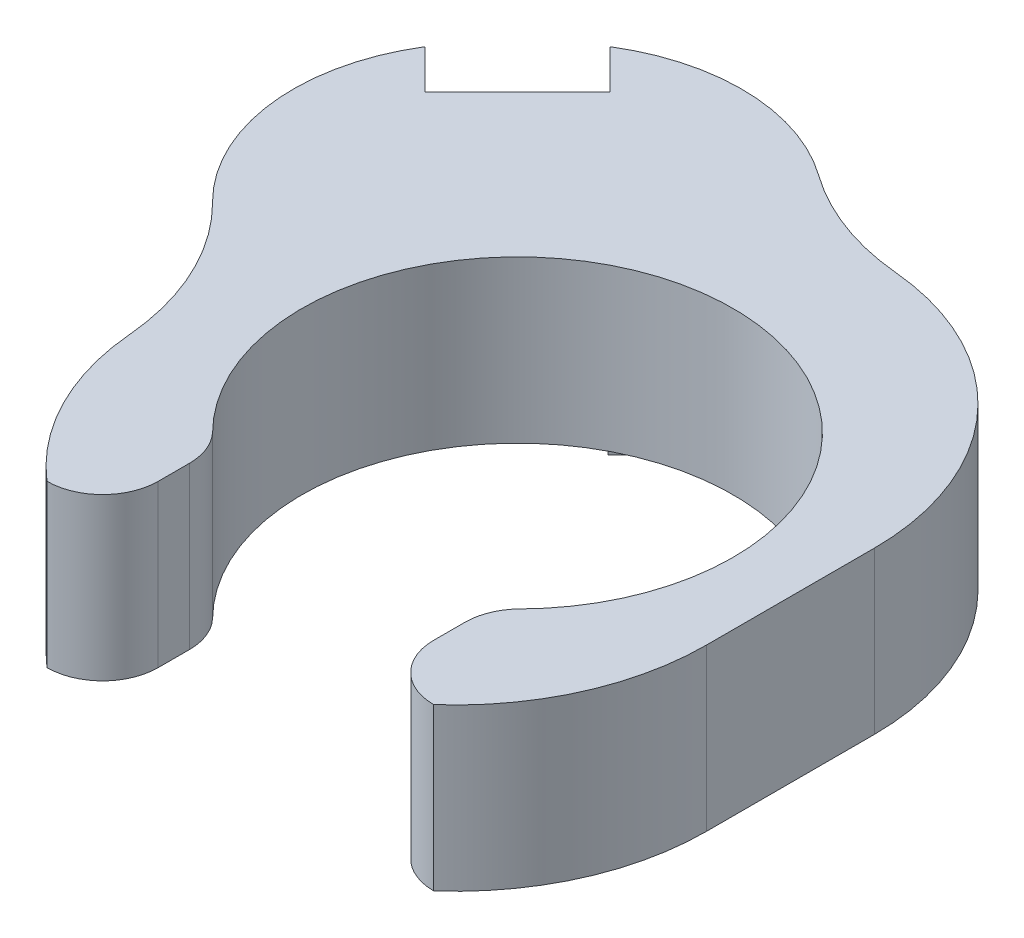
from build123d import *

# Parameters (mm, degrees)
BOSS_EXTRUDE1_DEPTH = 5.8
BOSS_EXTRUDE2_START = -5.8
BOSS_EXTRUDE2_DEPTH = 5.8
BOSS_EXTRUDE3_DEPTH = 10.3
CUT_EXTRUDE1_DEPTH  = 28.136753542647067
FILLET6_R           = 7
FILLET7_R           = 7
FILLET8_R           = 9
FILLET9_R           = 9
FILLET10_R          = 9
FILLET11_R          = 9
FILLET12_DEPTH      = 5.8
FILLET13_R          = 1.5
SKETCH11_W          = 21.348059672619552
SKETCH11_H          = 18.787798547860945
CUT_EXTRUDE3_DEPTH  = 3.048
BOSS_EXTRUDE4_DEPTH = 0.508


with BuildPart() as part:
    # Sketch1 → Boss-Extrude1 (new body)
    with BuildSketch(Plane(origin=(0, 0, 0), x_dir=(1, 0, 0), z_dir=(0, 1, 0))):
        with BuildLine():
            Line((10.000000000000004, 12.250000000000004), (-9.999999999999996, 12.250000000000002))
            Line((-9.999999999999996, 12.250000000000002), (-9.999999999999995, -7.463220606350221))
            Line((-9.999999999999995, -7.463220606350221), (-9.999999999999995, -9.463220606350236))
            Line((-9.999999999999995, -9.463220606350236), (-7.999999999999981, -9.463220606350236))
            Line((-7.999999999999981, -9.463220606350236), (-6.9500000000000055, -9.463220606350236))
            ThreePointArc((-6.9500000000000055, -9.463220606350236), (-5.535786437626896, -8.87743416872333), (-4.949999999999991, -7.46322060635022))
            Line((-4.949999999999991, -7.46322060635022), (-4.949999999999991, -6.3381283989115085))
            ThreePointArc((-4.949999999999991, -6.3381283989115085), (-5.099151268838792, -5.580263652166434), (-5.524358974358968, -4.935435394006584))
            ThreePointArc((-5.524358974358968, -4.935435394006584), (-2.97e-15, 8.249999999999998), (5.524358974358974, -4.935435394006577))
            ThreePointArc((5.524358974358974, -4.935435394006577), (5.0991512688388, -5.580263652166426), (4.95, -6.3381283989115))
            Line((4.95, -6.3381283989115), (4.95, -7.463220606350221))
            ThreePointArc((4.95, -7.463220606350221), (5.535786437626904, -8.87743416872333), (6.9500000000000135, -9.463220606350236))
            Line((6.9500000000000135, -9.463220606350236), (7.999999999999991, -9.463220606350236))
            Line((7.999999999999991, -9.463220606350236), (10.000000000000005, -9.463220606350236))
            Line((10.000000000000005, -9.463220606350236), (10.000000000000005, -7.463220606350221))
            Line((10.000000000000005, -7.463220606350221), (10.000000000000004, 12.250000000000004))
        make_face()
    extrude(amount=BOSS_EXTRUDE1_DEPTH)

    # Sketch5 → Boss-Extrude2 (add)
    with BuildSketch(Plane(origin=(0, 5.8, 0), x_dir=(1, 0, 0), z_dir=(0, 1, 0)).offset(BOSS_EXTRUDE2_START)):
        with BuildLine():
            Line((5.480077554195752, 5.980077554195732), (-6.5407377259755695, 18.00089283436707))
            Line((-6.5407377259755695, 18.00089283436707), (-17.500892834367058, 7.040737725975579))
            Line((-17.500892834367058, 7.040737725975579), (-5.480077554195753, -4.980077554195728))
            ThreePointArc((-5.480077554195753, -4.980077554195728), (-5.480077554195729, 5.980077554195754), (5.480077554195752, 5.980077554195732))
        make_face()
    extrude(amount=BOSS_EXTRUDE2_DEPTH)

    # Sketch7 → Boss-Extrude3 (add)
    with BuildSketch(Plane(origin=(0, 5.8, 0), x_dir=(1, 0, 0), z_dir=(0, 1, 0))):
        Polygon((-1.5909902576697432, 13.051145366061235), (-6.5407377259755775, 18.000892834367068), (-17.500892834367054, 7.040737725975589), (-12.551145366061204, 2.090990257669775), align=None)
    extrude(amount=-BOSS_EXTRUDE3_DEPTH)

    # Sketch8 → Cut-Extrude1 (cut, through all)
    with BuildSketch(Plane(origin=(0, 5.8, 0), x_dir=(1, 0, 0), z_dir=(0, 1, 0))):
        Polygon((-10.359114344382938, 14.1825162159597), (-8.944900782009844, 12.768302653586604), (-12.268302653586618, 9.444900782009832), (-13.682516215959716, 10.85911434438293), align=None)
    extrude(amount=-CUT_EXTRUDE1_DEPTH, mode=Mode.SUBTRACT)

    # Fillet6
    # the kernel refuses this fillet: 7 mm, written as the material it takes off along each edge
    with BuildSketch(Plane(origin=(-17.500892834367054, 22.8367250374008, -7.0407377259755775), x_dir=(0.7071067811865466, 0, 0.7071067811865486), z_dir=(0, -1, -4.3e-16))) as fillet6_piece_1:
        with BuildLine():
            CenterArc((6.814690014960312, -7.000000000000001), FILLET6_R, 89.99999999999993, 76.78701963984129)
            Line((-1.186e-14, -5.399999999999976), (-0.13629380029921795, -5.367999999999976))
            ThreePointArc((-0.13629380029921795, -5.367999999999976), (-0.1400000000000006, -2.6999999999999877), (-0.13999999999999937, -4.3e-16))
            Line((-0.13999999999999937, -4.3e-16), (8.2e-16, 0.13999999999999935))
            Line((8.2e-16, 0.13999999999999935), (6.81469001496032, 0.1400000000000004))
            Line((6.81469001496032, 0.1400000000000004), (6.814690014960321, -2.2e-16))
        make_face()
    extrude(amount=44.373450074801596, mode=Mode.SUBTRACT)

    # Fillet7
    # the kernel refuses this fillet: 7 mm, written as the material it takes off along each edge
    with BuildSketch(Plane(origin=(-6.540737725975586, -21.536725037400856, -18.00089283436706), x_dir=(0.7071067811865474, 0, 0.7071067811865478), z_dir=(5.2e-16, 1, -3.4e-16))) as fillet7_piece_1:
        with BuildLine():
            CenterArc((6.814690014960341, -7.000000000000002), FILLET7_R, 89.99999999999999, 76.78701963984157)
            Line((1e-14, -5.400000000000016), (-0.13629380029919633, -5.368000000000017))
            ThreePointArc((-0.13629380029919633, -5.368000000000017), (-0.13999999999999482, -2.700000000000007), (-0.13999999999999935, -6.8e-16))
            Line((-0.13999999999999935, -6.8e-16), (5.8e-16, 0.13999999999999937))
            Line((5.8e-16, 0.13999999999999937), (6.814690014960345, 0.13999999999999904))
            Line((6.814690014960345, 0.13999999999999904), (6.814690014960344, -5.9e-16))
        make_face()
    extrude(amount=44.37345007480171, mode=Mode.SUBTRACT)

    # Fillet8
    # the kernel refuses this fillet: 9 mm, written as the material it adds along each edge
    with BuildSketch(Plane(origin=(-0.7898448916085115, 5.8, -12.250000000000004), x_dir=(-0.7337802799425581, 0, -0.6793868564870981), z_dir=(0, -1, 0))) as fillet8_piece_1_section:
        with BuildLine():
            CenterArc((3.604279607820477, 8.928149183642457), FILLET8_R, 227.20425159265537, 35.551028784730306)
            Line((-2.510202100563517, 2.324126664159537), (-3.1216502714019168, 1.6637244122112442))
            Line((-3.1216502714019168, 1.6637244122112442), (-0.6114481708383885, -0.6604022519483025))
            Line((-0.6114481708383885, -0.6604022519483025), (0.03461576271957774, -0.8993340586074459))
            ThreePointArc((0.03461576271957774, -0.8993340586074459), (1.3519409332588244, -0.8486296344936657), (2.3558149078406787, -0.8928149183642455))
            Line((2.3558149078406787, -0.8928149183642455), (2.469311698747933, -1.2e-16))
        make_face()
    fillet8_piece_1 = extrude(amount=5.8, mode=Mode.PRIVATE)
    fillet8_piece_1 = split(fillet8_piece_1, bisect_by=Plane(origin=(-1.5909902576697426, 5.8, -13.051145366061235), z_dir=(-0.7071067811865475, 0, -0.7071067811865476)), keep=Keep.TOP, mode=Mode.PRIVATE)
    add(fillet8_piece_1)
    with BuildSketch(Plane(origin=(-0.7898448916085115, 5.8, -12.250000000000004), x_dir=(-0.7337802799425581, 0, -0.6793868564870981), z_dir=(0, -1, 0))) as fillet8_piece_2_section:
        with BuildLine():
            CenterArc((3.604279607820477, 8.928149183642457), FILLET8_R, 227.20425159265537, 35.551028784730306)
            Line((-2.510202100563517, 2.324126664159537), (-3.1216502714019168, 1.6637244122112442))
            Line((-3.1216502714019168, 1.6637244122112442), (-0.6114481708383885, -0.6604022519483025))
            Line((-0.6114481708383885, -0.6604022519483025), (0.03461576271957774, -0.8993340586074459))
            ThreePointArc((0.03461576271957774, -0.8993340586074459), (1.3519409332588244, -0.8486296344936657), (2.3558149078406787, -0.8928149183642455))
            Line((2.3558149078406787, -0.8928149183642455), (2.469311698747933, -1.2e-16))
        make_face()
    fillet8_piece_2 = extrude(amount=5.8, mode=Mode.PRIVATE)
    fillet8_piece_2 = split(fillet8_piece_2, bisect_by=Plane(origin=(-1.5909902576697428, 5.8, -13.051145366061235), z_dir=(0.7071067811865475, 0, 0.7071067811865476)), keep=Keep.TOP, mode=Mode.PRIVATE)
    add(fillet8_piece_2)
    with BuildSketch(Plane(origin=(-0.7898448916085115, 5.8, -12.250000000000004), x_dir=(-0.7337802799425581, 0, -0.6793868564870981), z_dir=(0, -1, 0))) as fillet8_piece_3_section:
        with BuildLine():
            CenterArc((3.604279607820477, 8.928149183642457), FILLET8_R, 227.20425159265537, 35.551028784730306)
            Line((-2.510202100563517, 2.324126664159537), (-3.1216502714019168, 1.6637244122112442))
            Line((-3.1216502714019168, 1.6637244122112442), (-0.6114481708383885, -0.6604022519483025))
            Line((-0.6114481708383885, -0.6604022519483025), (0.03461576271957774, -0.8993340586074459))
            ThreePointArc((0.03461576271957774, -0.8993340586074459), (1.3519409332588244, -0.8486296344936657), (2.3558149078406787, -0.8928149183642455))
            Line((2.3558149078406787, -0.8928149183642455), (2.469311698747933, -1.2e-16))
        make_face()
    fillet8_piece_3 = extrude(amount=14.35229477126272, mode=Mode.PRIVATE)
    fillet8_piece_3 = split(fillet8_piece_3, bisect_by=Plane(origin=(-0.7898448916085115, 0, -12.250000000000004), z_dir=(0, -1, 0)), keep=Keep.TOP, mode=Mode.PRIVATE)
    fillet8_piece_3 = split(fillet8_piece_3, bisect_by=Plane(origin=(-1.5909902576697426, 5.8, -13.051145366061235), z_dir=(-0.7071067811865475, 0, -0.7071067811865476)), keep=Keep.TOP, mode=Mode.PRIVATE)
    fillet8_piece_3 = split(fillet8_piece_3, bisect_by=Plane(origin=(-0.7898448916085115, -4.500000000000001, -12.250000000000004), z_dir=(0, 1, 0)), keep=Keep.TOP, mode=Mode.PRIVATE)
    add(fillet8_piece_3)

    # Fillet9
    fillet9_edges = [part.edges().sort_by_distance(p)[0] for p in [
        (10.000000000000004, 2.9, -12.250000000000004),
    ]]
    fillet(fillet9_edges, radius=FILLET9_R)

    # Fillet10
    fillet10_edges = [part.edges().sort_by_distance(p)[0] for p in [
        (-9.999999999999993, 2.9, 0.4601551083914859),
    ]]
    fillet(fillet10_edges, radius=FILLET10_R)

    # Fillet11
    # the kernel refuses this fillet: 9 mm, written as the material it takes off along each edge
    with BuildSketch(Plane(origin=(10.000000000000005, -16.88148023723037, 9.463220606350236), x_dir=(0, 0, -1), z_dir=(0, 1, 0))) as fillet11_piece_1:
        with BuildLine():
            CenterArc((6.752592094892147, 9), FILLET11_R, 221.38466758720216, 48.61533241279784)
            Line((0, 3.049999999999992), (0, 0))
            Line((0, 0), (6.752592094892147, 0))
        make_face()
    extrude(amount=39.56296047446074, mode=Mode.SUBTRACT)

    # Fillet12: read off the stored shape, not the designer's step
    # Fillet12 outline → Fillet12 (cut)
    with BuildSketch(Plane(origin=(0, 0, 0), x_dir=(1, 0, 0), z_dir=(0, 1, 0))):
        with BuildLine():
            Line((-10, -9.463220606), (-6.95, -9.463220606))
            ThreePointArc((-6.95, -9.463220606), (-9.082460071, -6.743546791), (-10.032769562, -3.42075828))
            ThreePointArc((-10.032769562, -3.42075828), (-10.008196123, -3.804068015), (-10, -4.18807717))
            Line((-10, -4.18807717), (-10, -9.463220606))
        make_face()
    extrude(amount=FILLET12_DEPTH, mode=Mode.SUBTRACT)

    # Fillet13
    fillet13_edges = [part.edges().sort_by_distance(p)[0] for p in [
        (-6.988797537188352, 0, -7.653338086542639),
    ]]
    fillet(fillet13_edges, radius=FILLET13_R)

    # Sketch11 → Cut-Extrude3 (cut)
    with BuildSketch(Plane.XZ.offset(4.500000000000001)):
        with Locations((-8.710392385955517, -8.235290372897843)):
            Rectangle(SKETCH11_W, SKETCH11_H)
    extrude(amount=-CUT_EXTRUDE3_DEPTH, mode=Mode.SUBTRACT)

    # Sketch12 → Boss-Extrude4 (add)
    # profile 1 of 2: a face of its own
    with BuildSketch(Plane.XZ.offset(1.4520000000000006)):
        with BuildLine():
            Line((-2.4493139974479754, -12.191735232078953), (-4.486372457650966, -14.228793692281943))
            Line((-4.486372457650966, -14.228793692281943), (-4.806448329045197, -13.908717820887713))
            add(Edge.make_bspline(
                [(-4.806448329045197, -13.908717820887713), (-4.828661024374683, -13.886231304815416), (-4.871642589971955, -13.842719896079144), (-4.932827018214561, -13.778904772564248), (-4.988017278573144, -13.71819010152893), (-5.036406306491011, -13.660368500302562), (-5.080827910208511, -13.607429398845492), (-5.118677717668075, -13.557500693759586), (-5.150420762286277, -13.5106709199942), (-5.168633218997069, -13.48008895452752), (-5.1772466062887865, -13.465625539904808)],
                knots=[0, 0, 0, 0, 1.3095301512040662, 2.533940850521988, 3.6626696936254968, 4.708054993179424, 5.657538352708242, 6.525514910263942, 7.302657991975732, 8, 8, 8, 8], degree=3))
            add(Edge.make_bspline(
                [(-5.1772466062887865, -13.465625539904808), (-5.187842601028913, -13.446534563265555), (-5.2087858884421365, -13.408800700559784), (-5.234653859414606, -13.350362101247825), (-5.25696630675732, -13.29204726749361), (-5.272061516660352, -13.232815974067822), (-5.284318443614258, -13.173957986698893), (-5.290459436987237, -13.114607234648858), (-5.292477913041739, -13.054949282641436), (-5.288731182383644, -12.995298780905507), (-5.280895188213855, -12.936314141313915), (-5.2672200690048525, -12.879040496393024), (-5.249296661396109, -12.823569862096324), (-5.226269371658625, -12.77020618908937), (-5.198887274637897, -12.718511777526354), (-5.165872049815261, -12.669079379038177), (-5.128822197033401, -12.620791108181308), (-5.100209992263962, -12.591411592777709), (-5.085713069296265, -12.576525897143055)],
                knots=[0, 0, 0, 0, 1.0843988317110433, 2.1433453828626807, 3.173002512387687, 4.182584465527969, 5.176855791756416, 6.157956129225085, 7.143371726200343, 8.139704303150209, 9.124362543420641, 10.09643921104711, 11.061439133823907, 12.017507275599723, 12.980911396755841, 13.963863450884553, 14.96835231880592, 16, 16, 16, 16], degree=3))
            add(Edge.make_bspline(
                [(-5.085713069296265, -12.576525897143055), (-5.066081448395113, -12.55819871271468), (-5.027595258637792, -12.522269764148513), (-4.964026643525775, -12.476714983794066), (-4.896423171417632, -12.441342249646695), (-4.82548427834829, -12.413179733309889), (-4.749281807646373, -12.39415817640882), (-4.667132664676729, -12.386237336501312), (-4.578987953048325, -12.385871718974483), (-4.518780725236573, -12.393169839792511), (-4.487538489969342, -12.39695692011314)],
                knots=[0, 0, 0, 0, 0.9906211896720665, 1.9420319532099628, 2.8757843080505054, 3.8002054120027546, 4.753561029508708, 5.763522269884867, 6.839465526752962, 8, 8, 8, 8], degree=3))
            add(Edge.make_bspline(
                [(-4.487538489969342, -12.39695692011314), (-4.495129128217594, -12.374479284480811), (-4.509946340471298, -12.330602091650238), (-4.528290258182384, -12.26492650482857), (-4.541774698003296, -12.200853715500916), (-4.5503787282777814, -12.138492574528716), (-4.555365195869259, -12.07814653941018), (-4.5554104714114585, -12.019449448671724), (-4.5506498827260105, -11.962558258260882), (-4.542061221808467, -11.90711089150498), (-4.528350347418086, -11.853411397808731), (-4.511080599589081, -11.800595577910926), (-4.488442452997314, -11.749501157216915), (-4.463251114019427, -11.698922930438162), (-4.432135397816626, -11.650700922914204), (-4.398814074752485, -11.602504644849958), (-4.359795508380228, -11.556432735900009), (-4.331637730787614, -11.5269520629409), (-4.3172977714864365, -11.511938390465707)],
                knots=[0, 0, 0, 0, 1.186658152946642, 2.316401486903811, 3.4088902402812287, 4.45926030913487, 5.463588718934022, 6.435736956572082, 7.391611320198099, 8.316992277827842, 9.238894347361978, 10.161155143638448, 11.092998657127824, 12.032115994447167, 12.984275517619578, 13.960691838287692, 14.961438062882385, 16, 16, 16, 16], degree=3))
            add(Edge.make_bspline(
                [(-4.3172977714864365, -11.511938390465707), (-4.288106332235452, -11.48479567748678), (-4.230608270522444, -11.431332969721584), (-4.1323657364224164, -11.367536356791724), (-4.0273800491991265, -11.318457264941184), (-3.9165248988821495, -11.285119998620825), (-3.803428749937276, -11.266565525881758), (-3.691202902339735, -11.262508231865112), (-3.5815294045429362, -11.275188479010724), (-3.492171092341306, -11.297893906465134), (-3.4216956118923423, -11.325108090724104), (-3.367403342249117, -11.350960219600344), (-3.3118254255499235, -11.381991072638744), (-3.2552720687527024, -11.418711532472713), (-3.19820411054165, -11.461855609401809), (-3.1393674605124775, -11.50934597134203), (-3.079616702235741, -11.562842976932403), (-3.0403472280907624, -11.601182034098217), (-3.0200868172930613, -11.620962412233869)],
                knots=[0, 0, 0, 0, 1.2988629635647237, 2.558356311029253, 3.803976536416101, 5.069968236100525, 6.32325052106894, 7.53521945680281, 8.722374383824311, 9.914533432289717, 10.532895509917337, 11.185408818458017, 11.875346277941459, 12.608912859798348, 13.383941006845168, 14.20904422574413, 15.075987124936347, 16, 16, 16, 16], degree=3))
            Line((-3.0200868172930613, -11.620962412233869), (-2.4493139974479754, -12.191735232078953))
        make_face()
        with BuildLine():
            Line((-4.504445958585795, -13.471455701496687), (-4.074763049264215, -13.041772792175108))
            Line((-4.074763049264215, -13.041772792175108), (-4.15930039234648, -12.957235449092842))
            add(Edge.make_bspline(
                [(-4.15930039234648, -12.957235449092842), (-4.182054109161808, -12.935772295859724), (-4.224590853496664, -12.895648184748262), (-4.293298477764093, -12.848722776200558), (-4.360863071035337, -12.818542182199355), (-4.427253633865441, -12.804923172129225), (-4.491172389207968, -12.807311022469793), (-4.551973381839538, -12.82408855260444), (-4.609516926603182, -12.855142045577276), (-4.6420573102965035, -12.885123166813843), (-4.658945240770625, -12.900682881651603)],
                knots=[0, 0, 0, 0, 1.3138754173600602, 2.456213337350045, 3.4809862581535542, 4.405731499558731, 5.280754247101059, 6.145141875977271, 7.037358768320755, 8, 8, 8, 8], degree=3))
            add(Edge.make_bspline(
                [(-4.658945240770625, -12.900682881651603), (-4.673499209866569, -12.916632555516353), (-4.7014570468913055, -12.947271509025786), (-4.7302042993353, -13.001479469261438), (-4.745675812066458, -13.058635814951778), (-4.748246443763366, -13.118938343114094), (-4.73515444403581, -13.181523515964253), (-4.706685995405667, -13.24534352432797), (-4.66238466847472, -13.310176200653911), (-4.624401962633145, -13.35033757854658), (-4.6041417218069505, -13.371759938275535)],
                knots=[0, 0, 0, 0, 0.9606737209126159, 1.8454319331149749, 2.7081452154180723, 3.584916115739206, 4.513733636969184, 5.535401243756681, 6.6853657938509325, 8, 8, 8, 8], degree=3))
            Line((-4.6041417218069505, -13.371759938275535), (-4.504445958585795, -13.471455701496687))
        make_face(mode=Mode.SUBTRACT)
        with BuildLine():
            Line((-3.72903446686571, -12.696044209776602), (-3.2066519882332316, -12.173661731144126))
            Line((-3.2066519882332316, -12.173661731144126), (-3.3034326706584456, -12.07688104871891))
            add(Edge.make_bspline(
                [(-3.3034326706584456, -12.07688104871891), (-3.3228960354827826, -12.057661608388367), (-3.3601848896571203, -12.020840076537828), (-3.4161878545338706, -11.970853878524396), (-3.4686172522044743, -11.927298056112045), (-3.5184211479640797, -11.89081504189986), (-3.5653033395545504, -11.861073242787253), (-3.609071146133967, -11.837946375369285), (-3.6498779152585885, -11.821678688204926), (-3.6881497531358716, -11.811974180424707), (-3.7246818201273375, -11.808716683319759), (-3.759741153609428, -11.80898540188898), (-3.79407838610983, -11.814374857995928), (-3.827330859690313, -11.824383614745626), (-3.859707338553869, -11.838669330176954), (-3.8914251362744685, -11.856686219152165), (-3.92183256302201, -11.879787781234592), (-3.94082364176553, -11.897526687805236), (-3.950580607357163, -11.906640330236005)],
                knots=[0, 0, 0, 0, 1.7213884438372724, 3.297919102835466, 4.72312422452204, 6.010026750867544, 7.180837236992057, 8.214843015158557, 9.121154809933076, 9.93995687948199, 10.689699253879281, 11.423711017894142, 12.141647582959276, 12.8692101959361, 13.603221959950957, 14.36484374909649, 15.159912741531066, 15.999999999999998, 15.999999999999998, 15.999999999999998, 15.999999999999998], degree=3))
            add(Edge.make_bspline(
                [(-3.950580607357163, -11.906640330236005), (-3.960954632972389, -11.917490633771314), (-3.981332744563942, -11.93880431704584), (-4.006773603361025, -11.974071009870993), (-4.028401671550394, -12.01029077418816), (-4.043758612018997, -12.048634363339154), (-4.055935841267806, -12.087708599255622), (-4.062133915696752, -12.128358685175714), (-4.063829417804363, -12.17018524065639), (-4.061087425054931, -12.213483557219448), (-4.052109927340347, -12.258367524022407), (-4.036588405725415, -12.30463060192503), (-4.0148650306591005, -12.352768375920965), (-3.9858137901844954, -12.402057631152681), (-3.951309975733831, -12.453558636343308), (-3.9104664539587635, -12.506749727410364), (-3.862162656902453, -12.560722042749605), (-3.8274832641581495, -12.596845957201808), (-3.809490696833659, -12.615587979808653)],
                knots=[0, 0, 0, 0, 0.8781377656832221, 1.7249609790424068, 2.5409348899264574, 3.3420090349022074, 4.137810496445241, 4.933042045364033, 5.741840667737007, 6.585982720766587, 7.467653661889752, 8.414225548382579, 9.43810654849673, 10.55475801972609, 11.76059302885576, 13.06727197564968, 14.478424728725628, 16, 16, 16, 16], degree=3))
            Line((-3.809490696833659, -12.615587979808653), (-3.72903446686571, -12.696044209776602))
        make_face(mode=Mode.SUBTRACT)
    # profile 2 of 2: a face of its own
    with BuildSketch(Plane.XZ.offset(1.4520000000000006)):
        with BuildLine():
            Line((-6.17481905337771, -12.540347096555204), (-6.586428461764462, -12.128737688168451))
            add(Edge.make_bspline(
                [(-6.586428461764462, -12.128737688168451), (-6.613419378920544, -12.101501322746081), (-6.665386936304851, -12.049061186131157), (-6.7376646480713145, -11.970679950074938), (-6.802586669329591, -11.896920434547917), (-6.859138252328032, -11.827051534724204), (-6.9078296793908365, -11.76154562187959), (-6.949001850459689, -11.700539054806574), (-6.981859646081555, -11.643215374881212), (-7.0154804281816805, -11.573186389314214), (-7.0424633017585485, -11.485153313829894), (-7.059520064239754, -11.377681908583765), (-7.057633013852739, -11.267114046461463), (-7.04297978062068, -11.174373200710681), (-7.023455249675638, -11.100095347409814), (-7.003068407355879, -11.044995938787862), (-6.979600992064313, -10.990699465126495), (-6.950432919482654, -10.938067389500848), (-6.917886027398487, -10.886187193481641), (-6.881225961281232, -10.835261637968301), (-6.839410690100509, -10.786221565662363), (-6.809300446051573, -10.754808295467505), (-6.7939822144354025, -10.73882716466418)],
                knots=[0, 0, 0, 0, 1.421930340682817, 2.73774492910374, 3.9533853882091616, 5.065461694998955, 6.070155989238138, 6.979658141311041, 7.793141596397994, 8.518526867825097, 9.85651774393024, 11.190776529083388, 12.538592053856243, 13.939156201973947, 14.662928508479094, 15.38335591053193, 16.11586694508016, 16.854415988154095, 17.61226495925529, 18.386422374173964, 19.179111409296333, 20, 20, 20, 20], degree=3))
            add(Edge.make_bspline(
                [(-6.7939822144354025, -10.73882716466418), (-6.77731724878981, -10.722619779724667), (-6.744606878829551, -10.690807559481659), (-6.692292435143899, -10.64856950864627), (-6.640131641800547, -10.610060854073899), (-6.586069318914256, -10.578208571322639), (-6.5316324946784245, -10.550553872886038), (-6.476293085918441, -10.52738503665655), (-6.419450325278659, -10.510881839043929), (-6.362042375922277, -10.498193524412516), (-6.303452778427178, -10.491491244938656), (-6.243995499014273, -10.488944693916467), (-6.183331275232673, -10.492037525114554), (-6.121725200772089, -10.50021679554426), (-6.059128996948455, -10.51364853463362), (-5.99586246565898, -10.532878512588951), (-5.9311247132084235, -10.555695032585161), (-5.8886173174742185, -10.57505776083814), (-5.866986521326427, -10.584910898638539)],
                knots=[0, 0, 0, 0, 1.101627221905933, 2.1622987261524407, 3.185277037659074, 4.172952073768893, 5.133121517363038, 6.079395382743494, 7.012294957074852, 7.935818418320913, 8.863881683119292, 9.804485684008348, 10.754699389485515, 11.73992131925364, 12.74839627287827, 13.786329815612588, 14.873526649424967, 16, 16, 16, 16], degree=3))
            Line((-5.866986521326427, -10.584910898638539), (-5.443716789755915, -9.197332439771017))
            Line((-5.443716789755915, -9.197332439771017), (-5.019864042026215, -9.621185187500718))
            Line((-5.019864042026215, -9.621185187500718), (-5.42447725650271, -10.942299804220802))
            Line((-5.42447725650271, -10.942299804220802), (-5.388330254633052, -10.978446806090462))
            Line((-5.388330254633052, -10.978446806090462), (-4.525466339034762, -10.115582890492169))
            Line((-4.525466339034762, -10.115582890492169), (-4.137760593174719, -10.503288636352213))
            Line((-4.137760593174719, -10.503288636352213), (-6.17481905337771, -12.540347096555204))
        make_face()
        with BuildLine():
            Line((-5.766124725786899, -11.356241277244306), (-5.887975103057197, -11.234390899974008))
            add(Edge.make_bspline(
                [(-5.887975103057197, -11.234390899974008), (-5.903010004803358, -11.219683456660496), (-5.931822127590136, -11.191498858597749), (-5.975222592119311, -11.153050844125197), (-6.01585627140842, -11.118897764735083), (-6.054922081586408, -11.090126614367259), (-6.092075155798603, -11.066978715393056), (-6.126713131725877, -11.048252533338673), (-6.159653861145971, -11.035359863796913), (-6.20023071305074, -11.024155940927479), (-6.251095717357853, -11.022361667215202), (-6.311333230095703, -11.037227783294597), (-6.36999397273306, -11.070035411786776), (-6.404384210266872, -11.101633167531396), (-6.422600921032624, -11.118370684295588)],
                knots=[0, 0, 0, 0, 1.2010739212456458, 2.301677116298011, 3.3107092303067835, 4.2320482093968845, 5.069760379083447, 5.809534460523837, 6.477361685220239, 7.085821740371535, 8.207766646162385, 9.338462351624445, 10.59016787874892, 12, 12, 12, 12], degree=3))
            add(Edge.make_bspline(
                [(-6.422600921032624, -11.118370684295588), (-6.432805665251784, -11.12959222156843), (-6.452736651153123, -11.151509115943542), (-6.47715280255619, -11.187920464123989), (-6.494235418008688, -11.227066580267653), (-6.504643512155369, -11.267845006618442), (-6.5087959214453734, -11.30933375926039), (-6.506430629532088, -11.35085151479208), (-6.497469894414964, -11.391885393636196), (-6.484904430037186, -11.425976946927163), (-6.469868721484159, -11.453767698258366), (-6.455568703215636, -11.477657614863908), (-6.436502229072567, -11.503159472900371), (-6.414140685060786, -11.531176314840799), (-6.388852461136444, -11.562199872869797), (-6.358561691434278, -11.594589248767255), (-6.325805463414253, -11.630219431441859), (-6.302006575470773, -11.654054029226673), (-6.2896732367377535, -11.66640587393234)],
                knots=[0, 0, 0, 0, 1.1284691279817298, 2.204024108479774, 3.247164670110387, 4.293011438081822, 5.325357643192699, 6.339905205241834, 7.375794653638513, 8.442749747062662, 9.03176661045778, 9.726624712846727, 10.513874097814421, 11.399736491574338, 12.396482678355964, 13.4924785024651, 14.700522810860884, 15.999999999999998, 15.999999999999998, 15.999999999999998, 15.999999999999998], degree=3))
            Line((-6.2896732367377535, -11.66640587393234), (-6.182981279606342, -11.773097831063751))
            Line((-6.182981279606342, -11.773097831063751), (-5.766124725786899, -11.356241277244306))
        make_face(mode=Mode.SUBTRACT)
    extrude(amount=BOSS_EXTRUDE4_DEPTH)


solid = part.part
